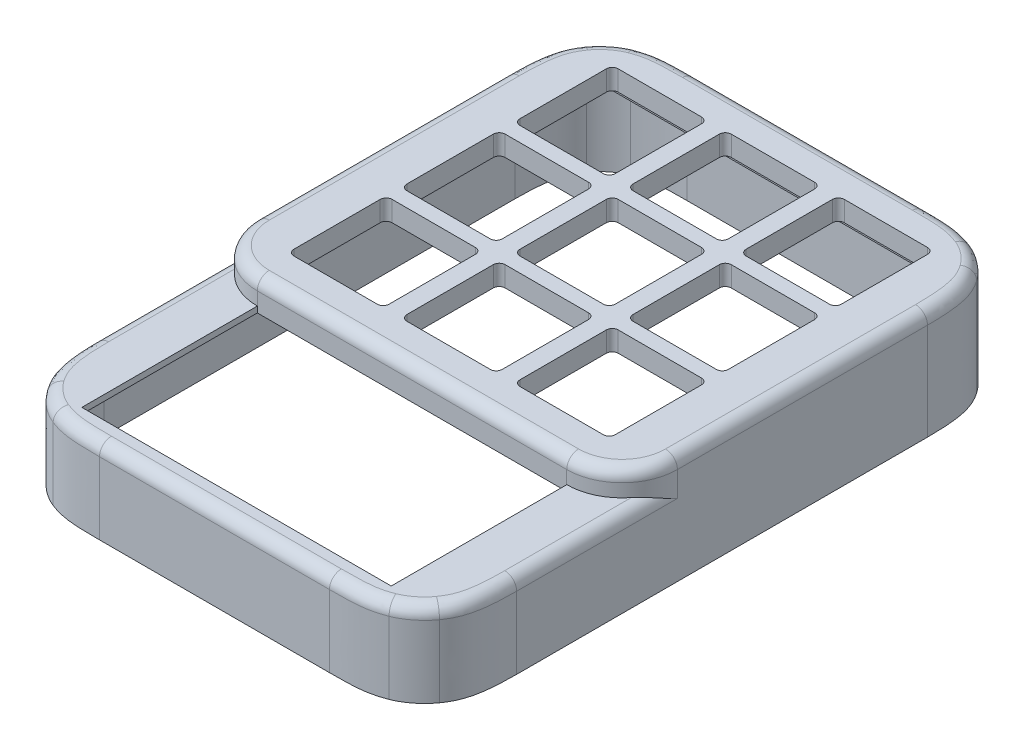
from build123d import *

# Parameters (mm, degrees)
BOSS_EXTRUDE1_DEPTH = 1
BOSS_EXTRUDE2_DEPTH = 13.1
CUT_EXTRUDE3_REACH  = 83.168
SKETCH6_W           = 52
SKETCH6_H           = 29.5
CUT_EXTRUDE4_REACH  = 83.168
SKETCH7_W           = 57
SKETCH7_H           = 57
SKETCH8_W           = 16
SKETCH8_H           = 16.5
BOSS_EXTRUDE4_DEPTH = 4.2
FILLET11_R          = 1
SKETCH14_W          = 57
SKETCH14_H          = 57
CUT_EXTRUDE6_DEPTH  = 0.8
FILLET3_R           = 9.3
FILLET9_R           = 2
FILLET10_R          = 2
BOSS_EXTRUDE6_REACH = 84.002
CUT_EXTRUDE9_DEPTH  = 2.5
CUT_EXTRUDE10_REACH = 83.311


with BuildPart() as part:
    # Sketch1 → Boss-Extrude1 (new body)
    with BuildSketch(Plane(origin=(0, 0, 0), x_dir=(1, 0, 0), z_dir=(0, 1, 0))):
        with BuildLine():
            Line((35.35115, -56.21475), (35.35115, 12.83055))
            add(Edge.make_bspline(
                [(33.00665, 23.45605), (34.45655, 21.36475), (35.35115, 19.24255), (35.35115, 12.83055)],
                knots=[0.9375, 0.9375, 0.9375, 0.9375, 1, 1, 1, 1], degree=3))
            add(Edge.make_bspline(
                [(28.27555, 27.19705), (29.75505, 26.63585), (31.72765, 25.30115), (33.00665, 23.45605)],
                knots=[0.875, 0.875, 0.875, 0.875, 0.9375, 0.9375, 0.9375, 0.9375], degree=3))
            add(Edge.make_bspline(
                [(19.37445, 28.30795), (24.25485, 28.30795), (25.81505, 28.13035), (28.27555, 27.19705)],
                knots=[0.8125, 0.8125, 0.8125, 0.8125, 0.875, 0.875, 0.875, 0.875], degree=3))
            Line((19.37445, 28.30795), (-19.27455, 28.30795))
            add(Edge.make_bspline(
                [(-28.17565, 27.19705), (-25.71515, 28.13035), (-24.15465, 28.30795), (-19.27455, 28.30795)],
                knots=[0.6875, 0.6875, 0.6875, 0.6875, 0.75, 0.75, 0.75, 0.75], degree=3))
            add(Edge.make_bspline(
                [(-32.90685, 23.45605), (-31.62805, 25.30085), (-29.65515, 26.63585), (-28.17565, 27.19705)],
                knots=[0.625, 0.625, 0.625, 0.625, 0.6875, 0.6875, 0.6875, 0.6875], degree=3))
            add(Edge.make_bspline(
                [(-35.25125, 12.83055), (-35.25125, 19.24185), (-34.35635, 21.36505), (-32.90685, 23.45605)],
                knots=[0.5625, 0.5625, 0.5625, 0.5625, 0.625, 0.625, 0.625, 0.625], degree=3))
            Line((-35.25125, 12.83055), (-35.25125, -56.21475))
            add(Edge.make_bspline(
                [(-32.90685, -66.84035), (-34.35675, -64.74885), (-35.25125, -62.62705), (-35.25125, -56.21475)],
                knots=[0.4375, 0.4375, 0.4375, 0.4375, 0.5, 0.5, 0.5, 0.5], degree=3))
            add(Edge.make_bspline(
                [(-28.17565, -70.58125), (-29.65515, -70.02015), (-31.62765, -68.68555), (-32.90685, -66.84035)],
                knots=[0.375, 0.375, 0.375, 0.375, 0.4375, 0.4375, 0.4375, 0.4375], degree=3))
            add(Edge.make_bspline(
                [(-19.27455, -71.69215), (-24.15465, -71.69215), (-25.71515, -71.51455), (-28.17565, -70.58125)],
                knots=[0.3125, 0.3125, 0.3125, 0.3125, 0.375, 0.375, 0.375, 0.375], degree=3))
            Line((-19.27455, -71.69215), (19.37445, -71.69215))
            add(Edge.make_bspline(
                [(28.27555, -70.58125), (25.81505, -71.51455), (24.25485, -71.69215), (19.37445, -71.69215)],
                knots=[0.1875, 0.1875, 0.1875, 0.1875, 0.25, 0.25, 0.25, 0.25], degree=3))
            add(Edge.make_bspline(
                [(33.00665, -66.84035), (31.72785, -68.68505), (29.75505, -70.02015), (28.27555, -70.58125)],
                knots=[0.125, 0.125, 0.125, 0.125, 0.1875, 0.1875, 0.1875, 0.1875], degree=3))
            add(Edge.make_bspline(
                [(35.35115, -56.21475), (35.35115, -62.62595), (34.45635, -64.74905), (33.00665, -66.84035)],
                knots=[0.0625, 0.0625, 0.0625, 0.0625, 0.125, 0.125, 0.125, 0.125], degree=3))
        make_face()
    extrude(amount=BOSS_EXTRUDE1_DEPTH)

    # Sketch2 → Boss-Extrude2 (add)
    with BuildSketch(Plane.XZ):
        with BuildLine():
            Line((-19.27455, -28.30795), (19.37445, -28.30795))
            add(Edge.make_bspline(
                [(19.37445, -28.30795), (24.25485, -28.30795), (25.81505, -28.13035), (28.27555, -27.19705)],
                knots=[0.8125, 0.8125, 0.8125, 0.8125, 0.875, 0.875, 0.875, 0.875], degree=3))
            add(Edge.make_bspline(
                [(28.27555, -27.19705), (29.75505, -26.63585), (31.72765, -25.30115), (33.00665, -23.45605)],
                knots=[0.875, 0.875, 0.875, 0.875, 0.9375, 0.9375, 0.9375, 0.9375], degree=3))
            add(Edge.make_bspline(
                [(33.00665, -23.45605), (34.45655, -21.36475), (35.35115, -19.24255), (35.35115, -12.83055)],
                knots=[0.9375, 0.9375, 0.9375, 0.9375, 1, 1, 1, 1], degree=3))
            Line((35.35115, -12.83055), (35.35115, 56.21475))
            add(Edge.make_bspline(
                [(35.35115, 56.21475), (35.35115, 62.62595), (34.45635, 64.74905), (33.00665, 66.84035)],
                knots=[0.0625, 0.0625, 0.0625, 0.0625, 0.125, 0.125, 0.125, 0.125], degree=3))
            add(Edge.make_bspline(
                [(33.00665, 66.84035), (31.72785, 68.68505), (29.75505, 70.02015), (28.27555, 70.58125)],
                knots=[0.125, 0.125, 0.125, 0.125, 0.1875, 0.1875, 0.1875, 0.1875], degree=3))
            add(Edge.make_bspline(
                [(28.27555, 70.58125), (25.81505, 71.51455), (24.25485, 71.69215), (19.37445, 71.69215)],
                knots=[0.1875, 0.1875, 0.1875, 0.1875, 0.25, 0.25, 0.25, 0.25], degree=3))
            Line((19.37445, 71.69215), (-19.27455, 71.69215))
            add(Edge.make_bspline(
                [(-19.27455, 71.69215), (-24.15465, 71.69215), (-25.71515, 71.51455), (-28.17565, 70.58125)],
                knots=[0.3125, 0.3125, 0.3125, 0.3125, 0.375, 0.375, 0.375, 0.375], degree=3))
            add(Edge.make_bspline(
                [(-28.17565, 70.58125), (-29.65515, 70.02015), (-31.62765, 68.68555), (-32.90685, 66.84035)],
                knots=[0.375, 0.375, 0.375, 0.375, 0.4375, 0.4375, 0.4375, 0.4375], degree=3))
            add(Edge.make_bspline(
                [(-32.90685, 66.84035), (-34.35675, 64.74885), (-35.25125, 62.62705), (-35.25125, 56.21475)],
                knots=[0.4375, 0.4375, 0.4375, 0.4375, 0.5, 0.5, 0.5, 0.5], degree=3))
            Line((-35.25125, 56.21475), (-35.25125, -12.83055))
            add(Edge.make_bspline(
                [(-35.25125, -12.83055), (-35.25125, -19.24185), (-34.35635, -21.36505), (-32.90685, -23.45605)],
                knots=[0.5625, 0.5625, 0.5625, 0.5625, 0.625, 0.625, 0.625, 0.625], degree=3))
            add(Edge.make_bspline(
                [(-32.90685, -23.45605), (-31.62805, -25.30085), (-29.65515, -26.63585), (-28.17565, -27.19705)],
                knots=[0.625, 0.625, 0.625, 0.625, 0.6875, 0.6875, 0.6875, 0.6875], degree=3))
            add(Edge.make_bspline(
                [(-28.17565, -27.19705), (-25.71515, -28.13035), (-24.15465, -28.30795), (-19.27455, -28.30795)],
                knots=[0.6875, 0.6875, 0.6875, 0.6875, 0.75, 0.75, 0.75, 0.75], degree=3))
        make_face()
        with BuildLine():
            Line((-19.27455, -27.30795), (19.37445, -27.30795))
            add(Edge.make_bspline(
                [(19.37445, -27.30795), (20.097060946, -27.30795), (20.819589368, -27.304598005), (22.264121488, -27.276580368), (22.986337989, -27.252889713), (24.428478085, -27.143708189), (25.14559959, -27.055972411), (26.559109231, -26.743541082), (27.244806482, -26.518502028), (27.920893475, -26.262053343)],
                knots=[0, 0, 0, 0, 0.25, 0.25, 0.5, 0.5, 0.75, 0.75, 1, 1, 1, 1], degree=3))
            add(Edge.make_bspline(
                [(27.920893475, -26.262053343), (28.352675841, -26.098270496), (28.760807487, -25.890033356), (29.549395843, -25.421540795), (29.929436873, -25.158687317), (30.649535806, -24.589106764), (30.992477619, -24.279888098), (31.628762448, -23.617694136), (31.922155218, -23.265240423), (32.184839954, -22.886288423)],
                knots=[0, 0, 0, 0, 0.25, 0.25, 0.5, 0.5, 0.75, 0.75, 1, 1, 1, 1], degree=3))
            add(Edge.make_bspline(
                [(32.184839954, -22.886288423), (32.43396191, -22.526961064), (32.669314485, -22.160642428), (33.085674765, -21.400412043), (33.266372793, -21.00634306), (33.570925213, -20.189343256), (33.695201163, -19.766668824), (33.89778364, -18.918146797), (33.977375594, -18.489724316), (34.172351178, -17.196056897), (34.245241984, -16.322434022), (34.335045677, -14.578066644), (34.35115, -13.704652401), (34.35115, -12.83055)],
                knots=[0, 0, 0, 0, 0.125, 0.125, 0.25, 0.25, 0.375, 0.375, 0.5, 0.5, 0.75, 0.75, 1, 1, 1, 1], degree=3))
            Line((34.35115, -12.83055), (34.35115, 56.21475))
            add(Edge.make_bspline(
                [(34.35115, 56.21475), (34.35115, 57.088243663), (34.335051386, 57.960841451), (34.245454128, 59.702842758), (34.173072665, 60.573652997), (33.977842821, 61.870757975), (33.898172859, 62.299771687), (33.695859985, 63.147920793), (33.572418474, 63.568649917), (33.267135849, 64.388638832), (33.086065896, 64.783668466), (32.669258691, 65.544950894), (32.433847787, 65.911375478), (32.184812418, 66.270628148)],
                knots=[0, 0, 0, 0, 0.25, 0.25, 0.5, 0.5, 0.625, 0.625, 0.75, 0.75, 0.875, 0.875, 1, 1, 1, 1], degree=3))
            add(Edge.make_bspline(
                [(32.184812418, 66.270628148), (31.922077075, 66.649630249), (31.628808651, 67.001843585), (30.993285165, 67.663290926), (30.650104882, 67.972806773), (29.930049957, 68.542438343), (29.550355911, 68.805141028), (28.760925351, 69.274219959), (28.352543995, 69.482549991), (27.920893474, 69.646253341)],
                knots=[0, 0, 0, 0, 0.25, 0.25, 0.5, 0.5, 0.75, 0.75, 1, 1, 1, 1], degree=3))
            add(Edge.make_bspline(
                [(27.920893474, 69.646253341), (27.244693458, 69.9027449), (26.558102527, 70.128025094), (25.144677968, 70.440314538), (24.427496656, 70.528011021), (22.985446784, 70.637128617), (22.263588846, 70.660794737), (20.819351791, 70.688798573), (20.09694608, 70.69215), (19.37445, 70.69215)],
                knots=[0, 0, 0, 0, 0.25, 0.25, 0.5, 0.5, 0.75, 0.75, 1, 1, 1, 1], degree=3))
            Line((19.37445, 70.69215), (-19.27455, 70.69215))
            add(Edge.make_bspline(
                [(-19.27455, 70.69215), (-19.997165278, 70.69215), (-20.719698011, 70.6887975), (-22.164238637, 70.660776327), (-22.886459334, 70.63708239), (-24.328607583, 70.527891828), (-25.045732791, 70.440150428), (-26.459251119, 70.127719079), (-27.144954133, 69.902683953), (-27.8210453, 69.646233685)],
                knots=[0, 0, 0, 0, 0.25, 0.25, 0.5, 0.5, 0.75, 0.75, 1, 1, 1, 1], degree=3))
            add(Edge.make_bspline(
                [(-27.8210453, 69.646233685), (-28.252831988, 69.482478694), (-28.660964754, 69.274259328), (-29.449553078, 68.805793294), (-29.829592522, 68.542948253), (-30.549686857, 67.973383294), (-30.8926258, 67.66417161), (-31.528913136, 67.001997273), (-31.822314681, 66.649558525), (-32.085014445, 66.270625223)],
                knots=[0, 0, 0, 0, 0.25, 0.25, 0.5, 0.5, 0.75, 0.75, 1, 1, 1, 1], degree=3))
            add(Edge.make_bspline(
                [(-32.085014445, 66.270625223), (-32.334122108, 65.911284113), (-32.56947008, 65.544956673), (-32.985829537, 64.78471304), (-33.166530263, 64.390639064), (-33.471083229, 63.573626921), (-33.595356553, 63.150947651), (-33.797931058, 62.30241536), (-33.87751785, 61.873987242), (-34.072477883, 60.580302338), (-34.145358376, 59.706669632), (-34.235148923, 57.962284316), (-34.25125, 57.088861185), (-34.25125, 56.21475)],
                knots=[0, 0, 0, 0, 0.125, 0.125, 0.25, 0.25, 0.375, 0.375, 0.5, 0.5, 0.75, 0.75, 1, 1, 1, 1], degree=3))
            Line((-34.25125, 56.21475), (-34.25125, -12.83055))
            add(Edge.make_bspline(
                [(-34.25125, -12.83055), (-34.25125, -13.704034904), (-34.235150197, -14.576623855), (-34.145551356, -16.318607496), (-34.073169261, -17.189408607), (-33.877946667, -18.48650122), (-33.798280575, -18.915511309), (-33.595980244, -19.763654765), (-33.472547744, -20.184381768), (-33.167286504, -21.004368738), (-32.986228597, -21.399398611), (-32.569438744, -22.160678926), (-32.334032161, -22.527100633), (-32.084997958, -22.886349007)],
                knots=[0, 0, 0, 0, 0.25, 0.25, 0.5, 0.5, 0.625, 0.625, 0.75, 0.75, 0.875, 0.875, 1, 1, 1, 1], degree=3))
            add(Edge.make_bspline(
                [(-32.084997958, -22.886349007), (-31.822266441, -23.265366135), (-31.528994836, -23.617588644), (-30.893456006, -24.279046913), (-30.550263457, -24.588564383), (-29.830183853, -25.15819581), (-29.450477358, -25.420896569), (-28.661026966, -25.88998238), (-28.252638799, -26.098322788), (-27.820990051, -26.262054642)],
                knots=[0, 0, 0, 0, 0.25, 0.25, 0.5, 0.5, 0.75, 0.75, 1, 1, 1, 1], degree=3))
            add(Edge.make_bspline(
                [(-27.820990051, -26.262054642), (-27.144790386, -26.518545955), (-26.458197143, -26.743816275), (-25.044772352, -27.056098388), (-24.32759189, -27.143798156), (-22.885543599, -27.252922259), (-22.16368637, -27.276591233), (-20.719450616, -27.304598104), (-19.997045503, -27.30795), (-19.27455, -27.30795)],
                knots=[0, 0, 0, 0, 0.25, 0.25, 0.5, 0.5, 0.75, 0.75, 1, 1, 1, 1], degree=3))
        make_face(mode=Mode.SUBTRACT)
    extrude(amount=BOSS_EXTRUDE2_DEPTH)

    # Sketch6 → Cut-Extrude3 (cut, up to next)
    with BuildSketch(Plane(origin=(0, 1, 0), x_dir=(1, 0, 0), z_dir=(0, 1, 0)), mode=Mode.PRIVATE) as cut_extrude3_sk1:
        with Locations((0.04995, -53.24215)):
            Rectangle(SKETCH6_W, SKETCH6_H)
    cut_extrude3_tool1 = extrude(cut_extrude3_sk1.sketch, amount=-CUT_EXTRUDE3_REACH, mode=Mode.PRIVATE) & part.part
    add(cut_extrude3_tool1.solids().sort_by_distance((0.04995, 1, 53.24215))[0], mode=Mode.SUBTRACT)

    # Sketch7 → Cut-Extrude4 (cut, up to next)
    with BuildSketch(Plane(origin=(0, 1, 0), x_dir=(1, 0, 0), z_dir=(0, 1, 0)), mode=Mode.PRIVATE) as cut_extrude4_sk1:
        with Locations((0, -5.09205)):
            Rectangle(SKETCH7_W, SKETCH7_H)
    cut_extrude4_tool1 = extrude(cut_extrude4_sk1.sketch, amount=-CUT_EXTRUDE4_REACH, mode=Mode.PRIVATE) & part.part
    add(cut_extrude4_tool1.solids().sort_by_distance((0, 1, 5.09205))[0], mode=Mode.SUBTRACT)

    # Sketch8 → Boss-Extrude4 (add)
    with BuildSketch(Plane(origin=(0, 1, 0), x_dir=(1, 0, 0), z_dir=(0, 1, 0))):
        with BuildLine():
            Line((35.35115, 12.83055), (35.35115, -38.49215))
            Line((35.35115, -38.49215), (-35.25125, -38.49215))
            Line((-35.25125, -38.49215), (-35.25125, 12.83055))
            add(Edge.make_bspline(
                [(-35.25125, 12.83055), (-35.25125, 19.24185), (-34.35635, 21.36505), (-32.90685, 23.45605)],
                knots=[0.5625, 0.5625, 0.5625, 0.5625, 0.625, 0.625, 0.625, 0.625], degree=3))
            add(Edge.make_bspline(
                [(-32.90685, 23.45605), (-31.62805, 25.30085), (-29.65515, 26.63585), (-28.17565, 27.19705)],
                knots=[0.625, 0.625, 0.625, 0.625, 0.6875, 0.6875, 0.6875, 0.6875], degree=3))
            add(Edge.make_bspline(
                [(-28.17565, 27.19705), (-25.71515, 28.13035), (-24.15465, 28.30795), (-19.27455, 28.30795)],
                knots=[0.6875, 0.6875, 0.6875, 0.6875, 0.75, 0.75, 0.75, 0.75], degree=3))
            Line((-19.27455, 28.30795), (19.37445, 28.30795))
            add(Edge.make_bspline(
                [(19.37445, 28.30795), (24.25485, 28.30795), (25.81505, 28.13035), (28.27555, 27.19705)],
                knots=[0.8125, 0.8125, 0.8125, 0.8125, 0.875, 0.875, 0.875, 0.875], degree=3))
            add(Edge.make_bspline(
                [(28.27555, 27.19705), (29.75505, 26.63585), (31.72765, 25.30115), (33.00665, 23.45605)],
                knots=[0.875, 0.875, 0.875, 0.875, 0.9375, 0.9375, 0.9375, 0.9375], degree=3))
            add(Edge.make_bspline(
                [(33.00665, 23.45605), (34.45655, 21.36475), (35.35115, 19.24255), (35.35115, 12.83055)],
                knots=[0.9375, 0.9375, 0.9375, 0.9375, 1, 1, 1, 1], degree=3))
        make_face()
        with Locations((0.04875, -24.09205)):
            Rectangle(SKETCH8_W, SKETCH8_H, mode=Mode.SUBTRACT)
        with Locations((-18.95125, -24.09205)):
            Rectangle(SKETCH8_W, SKETCH8_H, mode=Mode.SUBTRACT)
        with Locations((19.04875, -24.09205)):
            Rectangle(SKETCH8_W, SKETCH8_H, mode=Mode.SUBTRACT)
        with Locations((0.04875, -5.09205)):
            Rectangle(SKETCH8_W, SKETCH8_H, mode=Mode.SUBTRACT)
        with Locations((19.04875, -5.09205)):
            Rectangle(SKETCH8_W, SKETCH8_H, mode=Mode.SUBTRACT)
        with Locations((0.04875, 13.90795)):
            Rectangle(SKETCH8_W, SKETCH8_H, mode=Mode.SUBTRACT)
        with Locations((19.04875, 13.90795)):
            Rectangle(SKETCH8_W, SKETCH8_H, mode=Mode.SUBTRACT)
        with Locations((-18.95125, -5.09205)):
            Rectangle(SKETCH8_W, SKETCH8_H, mode=Mode.SUBTRACT)
        with Locations((-18.95125, 13.90795)):
            Rectangle(SKETCH8_W, SKETCH8_H, mode=Mode.SUBTRACT)
    extrude(amount=BOSS_EXTRUDE4_DEPTH)

    # Fillet11
    fillet11_edges = [part.edges().sort_by_distance(p)[0] for p in [
        (-26.95125, 3.1, 32.34205),
        (-10.95125, 3.1, 32.34205),
        (-10.95125, 3.1, 15.84205),
        (-26.95125, 3.1, 15.84205),
        (11.04875, 3.1, 32.34205),
        (27.04875, 3.1, 32.34205),
        (27.04875, 3.1, 15.84205),
        (11.04875, 3.1, 15.84205),
        (-7.95125, 3.1, 32.34205),
        (8.04875, 3.1, 32.34205),
        (8.04875, 3.1, 15.84205),
        (-7.95125, 3.1, 15.84205),
        (27.04875, 3.1, -5.65795),
        (27.04875, 3.1, -22.15795),
        (11.04875, 3.1, -22.15795),
        (11.04875, 3.1, -5.65795),
        (8.04875, 3.1, -5.65795),
        (8.04875, 3.1, -22.15795),
        (-7.95125, 3.1, -22.15795),
        (-7.95125, 3.1, -5.65795),
        (-10.95125, 3.1, -5.65795),
        (-10.95125, 3.1, -22.15795),
        (-26.95125, 3.1, -22.15795),
        (-26.95125, 3.1, -5.65795),
        (-26.95125, 3.1, -3.15795),
        (-26.95125, 3.1, 13.34205),
        (-10.95125, 3.1, 13.34205),
        (-10.95125, 3.1, -3.15795),
        (-7.95125, 3.1, -3.15795),
        (-7.95125, 3.1, 13.34205),
        (8.04875, 3.1, 13.34205),
        (8.04875, 3.1, -3.15795),
        (27.04875, 3.1, -3.15795),
        (11.04875, 3.1, -3.15795),
        (11.04875, 3.1, 13.34205),
        (27.04875, 3.1, 13.34205),
    ]]
    fillet(fillet11_edges, radius=FILLET11_R)

    # Sketch14 → Cut-Extrude6 (cut)
    with BuildSketch(Plane.XZ.offset(-1)):
        with Locations((0, 5.09205)):
            Rectangle(SKETCH14_W, SKETCH14_H)
    extrude(amount=-CUT_EXTRUDE6_DEPTH, mode=Mode.SUBTRACT)

    # Fillet3
    fillet3_edges = [part.edges().sort_by_distance(p)[0] for p in [
        (35.35115, 3.1, 38.49215),
        (-35.25125, 3.1, 38.49215),
    ]]
    fillet(fillet3_edges, radius=FILLET3_R)

    # Fillet9
    fillet9_edges = [part.edges().sort_by_distance(p)[0] for p in [
        (32.627243065, 5.2, 35.768243065),
        (0.04995, 5.2, 38.49215),
        (-32.527343065, 5.2, 35.768243065),
        (-35.25125, 5.2, 8.1808),
        (-34.908906348, 5.2, -18.351755693),
        (-30.805861085, 5.2, -25.661431125),
        (-23.787772134, 5.2, -28.187276577),
        (0.04995, 5.2, -28.30795),
        (23.887674231, 5.2, -28.187286804),
        (30.905739054, 5.2, -25.661461483),
        (35.008905549, 5.2, -18.351813117),
        (35.35115, 5.2, 8.1808),
    ]]
    fillet(fillet9_edges, radius=FILLET9_R)

    # Fillet10
    fillet10_edges = [part.edges().sort_by_distance(p)[0] for p in [
        (-35.25125, 1, 42.70345),
        (-34.909047646, 1, 61.736050705),
        (-30.805889061, 1, 69.045732795),
        (-23.787772178, 1, 71.571476573),
        (0.04995, 1, 71.69215),
        (23.887674187, 1, 71.571486808),
        (30.905704758, 1, 69.04568168),
        (35.008802154, 1, 61.736021793),
        (35.35115, 1, 42.70345),
    ]]
    fillet(fillet10_edges, radius=FILLET10_R)

    # Sketch17 → Boss-Extrude6 (add, up to next)
    with BuildSketch(Plane.XZ.offset(13.1), mode=Mode.PRIVATE) as boss_extrude6_sk1:
        with BuildLine():
            Line((-19.27455, -27.30795), (19.37445, -27.30795))
            add(Edge.make_bspline(
                [(19.37445, -27.30795), (20.097060946, -27.30795), (20.819589368, -27.304598005), (22.264121488, -27.276580368), (22.986337989, -27.252889713), (24.428478085, -27.143708189), (25.14559959, -27.055972411), (26.559109231, -26.743541082), (27.244806482, -26.518502028), (27.920893475, -26.262053343)],
                knots=[0, 0, 0, 0, 0.25, 0.25, 0.5, 0.5, 0.75, 0.75, 1, 1, 1, 1], degree=3))
            add(Edge.make_bspline(
                [(27.920893475, -26.262053343), (28.352675841, -26.098270496), (28.760807487, -25.890033356), (29.549395843, -25.421540795), (29.929436873, -25.158687317), (30.649535806, -24.589106764), (30.992477619, -24.279888098), (31.628762448, -23.617694136), (31.922155218, -23.265240423), (32.184839954, -22.886288423)],
                knots=[0, 0, 0, 0, 0.25, 0.25, 0.5, 0.5, 0.75, 0.75, 1, 1, 1, 1], degree=3))
            add(Edge.make_bspline(
                [(32.184839954, -22.886288423), (32.43396191, -22.526961064), (32.669314485, -22.160642428), (33.085674765, -21.400412043), (33.266372793, -21.00634306), (33.570925213, -20.189343256), (33.695201163, -19.766668824), (33.89778364, -18.918146797), (33.977375594, -18.489724316), (34.172351178, -17.196056897), (34.245241984, -16.322434022), (34.335045677, -14.578066644), (34.35115, -13.704652401), (34.35115, -12.83055)],
                knots=[0, 0, 0, 0, 0.125, 0.125, 0.25, 0.25, 0.375, 0.375, 0.5, 0.5, 0.75, 0.75, 1, 1, 1, 1], degree=3))
            Line((34.35115, -12.83055), (34.35115, 56.21475))
            add(Edge.make_bspline(
                [(34.35115, 56.21475), (34.35115, 57.088243663), (34.335051386, 57.960841451), (34.245454128, 59.702842758), (34.173072665, 60.573652997), (33.977842821, 61.870757975), (33.898172859, 62.299771687), (33.695859985, 63.147920793), (33.572418474, 63.568649917), (33.267135849, 64.388638832), (33.086065896, 64.783668466), (32.669258691, 65.544950894), (32.433847787, 65.911375478), (32.184812418, 66.270628148)],
                knots=[0, 0, 0, 0, 0.25, 0.25, 0.5, 0.5, 0.625, 0.625, 0.75, 0.75, 0.875, 0.875, 1, 1, 1, 1], degree=3))
            add(Edge.make_bspline(
                [(32.184812418, 66.270628148), (31.922077075, 66.649630249), (31.628808651, 67.001843585), (30.993285165, 67.663290926), (30.650104882, 67.972806773), (29.930049957, 68.542438343), (29.550355911, 68.805141028), (28.760925351, 69.274219959), (28.352543995, 69.482549991), (27.920893474, 69.646253341)],
                knots=[0, 0, 0, 0, 0.25, 0.25, 0.5, 0.5, 0.75, 0.75, 1, 1, 1, 1], degree=3))
            add(Edge.make_bspline(
                [(27.920893474, 69.646253341), (27.244693458, 69.9027449), (26.558102527, 70.128025094), (25.144677968, 70.440314538), (24.427496656, 70.528011021), (22.985446784, 70.637128617), (22.263588846, 70.660794737), (20.819351791, 70.688798573), (20.09694608, 70.69215), (19.37445, 70.69215)],
                knots=[0, 0, 0, 0, 0.25, 0.25, 0.5, 0.5, 0.75, 0.75, 1, 1, 1, 1], degree=3))
            Line((19.37445, 70.69215), (-19.27455, 70.69215))
            add(Edge.make_bspline(
                [(-19.27455, 70.69215), (-19.997165278, 70.69215), (-20.719698011, 70.6887975), (-22.164238637, 70.660776327), (-22.886459334, 70.63708239), (-24.328607583, 70.527891828), (-25.045732791, 70.440150428), (-26.459251119, 70.127719079), (-27.144954133, 69.902683953), (-27.8210453, 69.646233685)],
                knots=[0, 0, 0, 0, 0.25, 0.25, 0.5, 0.5, 0.75, 0.75, 1, 1, 1, 1], degree=3))
            add(Edge.make_bspline(
                [(-27.8210453, 69.646233685), (-28.252831988, 69.482478694), (-28.660964754, 69.274259328), (-29.449553078, 68.805793294), (-29.829592522, 68.542948253), (-30.549686857, 67.973383294), (-30.8926258, 67.66417161), (-31.528913136, 67.001997273), (-31.822314681, 66.649558525), (-32.085014445, 66.270625223)],
                knots=[0, 0, 0, 0, 0.25, 0.25, 0.5, 0.5, 0.75, 0.75, 1, 1, 1, 1], degree=3))
            add(Edge.make_bspline(
                [(-32.085014445, 66.270625223), (-32.334122108, 65.911284113), (-32.56947008, 65.544956673), (-32.985829537, 64.78471304), (-33.166530263, 64.390639064), (-33.471083229, 63.573626921), (-33.595356553, 63.150947651), (-33.797931058, 62.30241536), (-33.87751785, 61.873987242), (-34.072477883, 60.580302338), (-34.145358376, 59.706669632), (-34.235148923, 57.962284316), (-34.25125, 57.088861185), (-34.25125, 56.21475)],
                knots=[0, 0, 0, 0, 0.125, 0.125, 0.25, 0.25, 0.375, 0.375, 0.5, 0.5, 0.75, 0.75, 1, 1, 1, 1], degree=3))
            Line((-34.25125, 56.21475), (-34.25125, -12.83055))
            add(Edge.make_bspline(
                [(-34.25125, -12.83055), (-34.25125, -13.704034904), (-34.235150197, -14.576623855), (-34.145551356, -16.318607496), (-34.073169261, -17.189408607), (-33.877946667, -18.48650122), (-33.798280575, -18.915511309), (-33.595980244, -19.763654765), (-33.472547744, -20.184381768), (-33.167286504, -21.004368738), (-32.986228597, -21.399398611), (-32.569438744, -22.160678926), (-32.334032161, -22.527100633), (-32.084997958, -22.886349007)],
                knots=[0, 0, 0, 0, 0.25, 0.25, 0.5, 0.5, 0.625, 0.625, 0.75, 0.75, 0.875, 0.875, 1, 1, 1, 1], degree=3))
            add(Edge.make_bspline(
                [(-32.084997958, -22.886349007), (-31.822266441, -23.265366135), (-31.528994836, -23.617588644), (-30.893456006, -24.279046913), (-30.550263457, -24.588564383), (-29.830183853, -25.15819581), (-29.450477358, -25.420896569), (-28.661026966, -25.88998238), (-28.252638799, -26.098322788), (-27.820990051, -26.262054642)],
                knots=[0, 0, 0, 0, 0.25, 0.25, 0.5, 0.5, 0.75, 0.75, 1, 1, 1, 1], degree=3))
            add(Edge.make_bspline(
                [(-27.820990051, -26.262054642), (-27.144790386, -26.518545955), (-26.458197143, -26.743816275), (-25.044772352, -27.056098388), (-24.32759189, -27.143798156), (-22.885543599, -27.252922259), (-22.16368637, -27.276591233), (-20.719450616, -27.304598104), (-19.997045503, -27.30795), (-19.27455, -27.30795)],
                knots=[0, 0, 0, 0, 0.25, 0.25, 0.5, 0.5, 0.75, 0.75, 1, 1, 1, 1], degree=3))
        make_face()
        with BuildLine():
            Line((-34.00125, 56.21475), (-34.00125, -12.83055))
            add(Edge.make_bspline(
                [(-34.00125, -12.83055), (-34.00125, -13.691925477), (-33.985562177, -14.552919093), (-33.898003985, -16.273538779), (-33.827537787, -17.131533638), (-33.574032817, -18.83575861), (-33.391934839, -19.674274379), (-32.951455069, -20.872282048), (-32.775340915, -21.261764865), (-32.362434592, -22.020316888), (-32.126846311, -22.387160695), (-31.879536613, -22.743921356)],
                knots=[0, 0, 0, 0, 0.25, 0.25, 0.5, 0.5, 0.75, 0.75, 0.875, 0.875, 1, 1, 1, 1], degree=3))
            add(Edge.make_bspline(
                [(-31.879536613, -22.743921356), (-31.623963885, -23.112611197), (-31.337965526, -23.455924974), (-30.716892495, -24.101621128), (-30.38409695, -24.401401855), (-29.681692736, -24.956740858), (-29.313500034, -25.211277434), (-28.549212409, -25.665823446), (-28.153123911, -25.868689503), (-27.732325063, -26.028305802)],
                knots=[0, 0, 0, 0, 0.25, 0.25, 0.5, 0.5, 0.75, 0.75, 1, 1, 1, 1], degree=3))
            add(Edge.make_bspline(
                [(-27.732325063, -26.028305802), (-27.063320158, -26.282068019), (-26.384856594, -26.504806318), (-24.98584815, -26.812258349), (-24.275926202, -26.897698055), (-22.84908946, -27.004235712), (-22.134165124, -27.027283439), (-20.704638781, -27.054667515), (-19.989632691, -27.05795), (-19.27455, -27.05795)],
                knots=[0, 0, 0, 0, 0.25, 0.25, 0.5, 0.5, 0.75, 0.75, 1, 1, 1, 1], degree=3))
            Line((-19.27455, -27.05795), (19.37445, -27.05795))
            add(Edge.make_bspline(
                [(19.37445, -27.05795), (20.091382106, -27.05795), (20.808287024, -27.054652814), (22.241923871, -27.02707934), (22.958358575, -27.003855164), (24.388468711, -26.896449994), (25.097399937, -26.810077466), (26.484096403, -26.504596139), (27.1618097, -26.282603164), (27.832229344, -26.028304178)],
                knots=[0, 0, 0, 0, 0.25, 0.25, 0.5, 0.5, 0.75, 0.75, 1, 1, 1, 1], degree=3))
            add(Edge.make_bspline(
                [(27.832229344, -26.028304178), (28.252122852, -25.869030907), (28.64995351, -25.66556857), (29.419925028, -25.207190518), (29.788085312, -24.952074859), (30.490265306, -24.395995953), (30.822325654, -24.096143714), (31.43835008, -23.455037938), (31.72344809, -23.113069061), (31.979387443, -22.743848028)],
                knots=[0, 0, 0, 0, 0.25, 0.25, 0.5, 0.5, 0.75, 0.75, 1, 1, 1, 1], degree=3))
            add(Edge.make_bspline(
                [(31.979387443, -22.743848028), (32.225108751, -22.38942568), (32.456987243, -22.02852279), (32.865705125, -21.280950349), (33.042266881, -20.894150823), (33.338736644, -20.094029211), (33.459900703, -19.679343552), (33.658735983, -18.838941197), (33.736423109, -18.415490637), (33.926721574, -17.138744578), (33.997643205, -16.278035264), (34.08542153, -14.555450217), (34.10115, -13.693252809), (34.10115, -12.83055)],
                knots=[0, 0, 0, 0, 0.125, 0.125, 0.25, 0.25, 0.375, 0.375, 0.5, 0.5, 0.75, 0.75, 1, 1, 1, 1], degree=3))
            Line((34.10115, -12.83055), (34.10115, 56.21475))
            add(Edge.make_bspline(
                [(34.10115, 56.21475), (34.10115, 57.076134395), (34.085463336, 57.937136976), (33.997906681, 59.657774628), (33.927441153, 60.515778445), (33.673926704, 62.220020172), (33.491816807, 63.058542279), (33.051304561, 64.256554232), (32.875177536, 64.646037782), (32.4622519, 65.404593422), (32.226660855, 65.771437119), (31.979350588, 66.128201197)],
                knots=[0, 0, 0, 0, 0.25, 0.25, 0.5, 0.5, 0.75, 0.75, 0.875, 0.875, 1, 1, 1, 1], degree=3))
            add(Edge.make_bspline(
                [(31.979350588, 66.128201197), (31.723765359, 66.496888645), (31.437740163, 66.840230168), (30.816569915, 67.486013429), (30.483825465, 67.785746941), (29.781288245, 68.341184029), (29.413300796, 68.595569574), (28.649141518, 69.050041295), (28.253082814, 69.252895604), (27.832229342, 69.412504177)],
                knots=[0, 0, 0, 0, 0.25, 0.25, 0.5, 0.5, 0.75, 0.75, 1, 1, 1, 1], degree=3))
            add(Edge.make_bspline(
                [(27.832229342, 69.412504177), (27.163224078, 69.666266672), (26.4847629, 69.889014987), (25.085754394, 70.196474436), (24.375831428, 70.281910745), (22.94899298, 70.388441953), (22.234067884, 70.411486871), (20.804540106, 70.438867974), (20.089533344, 70.44215), (19.37445, 70.44215)],
                knots=[0, 0, 0, 0, 0.25, 0.25, 0.5, 0.5, 0.75, 0.75, 1, 1, 1, 1], degree=3))
            Line((19.37445, 70.44215), (-19.27455, 70.44215))
            add(Edge.make_bspline(
                [(-19.27455, 70.44215), (-19.991487461, 70.44215), (-20.708397727, 70.438852307), (-22.142045227, 70.411275236), (-22.858485154, 70.388047705), (-24.288605341, 70.280633019), (-24.997541214, 70.194254371), (-26.384249217, 69.888771041), (-27.061969037, 69.666780656), (-27.732394125, 69.412479606)],
                knots=[0, 0, 0, 0, 0.25, 0.25, 0.5, 0.5, 0.75, 0.75, 1, 1, 1, 1], degree=3))
            add(Edge.make_bspline(
                [(-27.732394125, 69.412479606), (-28.152289786, 69.253234285), (-28.550119716, 69.049789984), (-29.3200879, 68.591439416), (-29.688244682, 68.336333101), (-30.390416976, 67.780271902), (-30.722473758, 67.480427286), (-31.338499138, 66.83934279), (-31.62360559, 66.497391033), (-31.879558125, 66.128190324)],
                knots=[0, 0, 0, 0, 0.25, 0.25, 0.5, 0.5, 0.75, 0.75, 1, 1, 1, 1], degree=3))
            add(Edge.make_bspline(
                [(-31.879558125, 66.128190324), (-32.125265252, 65.773754346), (-32.35713921, 65.412842801), (-32.765856225, 64.665258703), (-32.942420462, 64.27845563), (-33.238890102, 63.478326412), (-33.360051637, 63.06363816), (-33.558880655, 62.223221745), (-33.63656304, 61.799764475), (-33.826846949, 60.522999342), (-33.897758777, 59.662279094), (-33.985524647, 57.939671726), (-34.00125, 57.077463458), (-34.00125, 56.21475)],
                knots=[0, 0, 0, 0, 0.125, 0.125, 0.25, 0.25, 0.375, 0.375, 0.5, 0.5, 0.75, 0.75, 1, 1, 1, 1], degree=3))
        make_face(mode=Mode.SUBTRACT)
    boss_extrude6_tool1 = extrude(boss_extrude6_sk1.sketch, amount=-BOSS_EXTRUDE6_REACH, mode=Mode.PRIVATE) - part.part
    add(boss_extrude6_tool1.solids().sort_by_distance((0.04995, -13.1, -27.188324))[0])

    # Sketch19 → Cut-Extrude9 (cut)
    with BuildSketch(Plane.XZ):
        with BuildLine():
            Line((29.90115, 20.5), (29.30115, 20.5))
            ThreePointArc((29.30115, 20.5), (28.381911184, 20.880761184), (28.00115, 21.8))
            Line((28.00115, 21.8), (28.00115, 28.2))
            ThreePointArc((28.00115, 28.2), (28.381911184, 29.119238816), (29.30115, 29.5))
            Line((29.30115, 29.5), (29.90115, 29.5))
            ThreePointArc((29.90115, 29.5), (30.820388816, 29.119238816), (31.20115, 28.2))
            Line((31.20115, 28.2), (31.20115, 21.8))
            ThreePointArc((31.20115, 21.8), (30.820388816, 20.880761184), (29.90115, 20.5))
        make_face()
    extrude(amount=-CUT_EXTRUDE9_DEPTH, mode=Mode.SUBTRACT)

    # Sketch25 → Cut-Extrude10 (cut, up to next)
    with BuildSketch(Plane.XZ.offset(-1.8), mode=Mode.PRIVATE) as cut_extrude10_sk1:
        with BuildLine():
            Line((28.30115, 21.8), (28.30115, 28.2))
            ThreePointArc((28.30115, 28.2), (28.434792683, 28.699424669), (28.8, 29.065360432))
            Line((28.8, 29.065360432), (28.8, 33.89205))
            Line((28.8, 33.89205), (-28.8, 33.89205))
            Line((-28.8, 33.89205), (-28.8, -23.70795))
            Line((-28.8, -23.70795), (28.8, -23.70795))
            Line((28.8, -23.70795), (28.8, 20.934639568))
            ThreePointArc((28.8, 20.934639568), (28.434792683, 21.300575331), (28.30115, 21.8))
        make_face()
    cut_extrude10_tool1 = extrude(cut_extrude10_sk1.sketch, amount=CUT_EXTRUDE10_REACH, mode=Mode.PRIVATE) & part.part
    add(cut_extrude10_tool1.solids().sort_by_distance((-0.032788, 1.8, 5.069193))[0], mode=Mode.SUBTRACT)


solid = part.part
